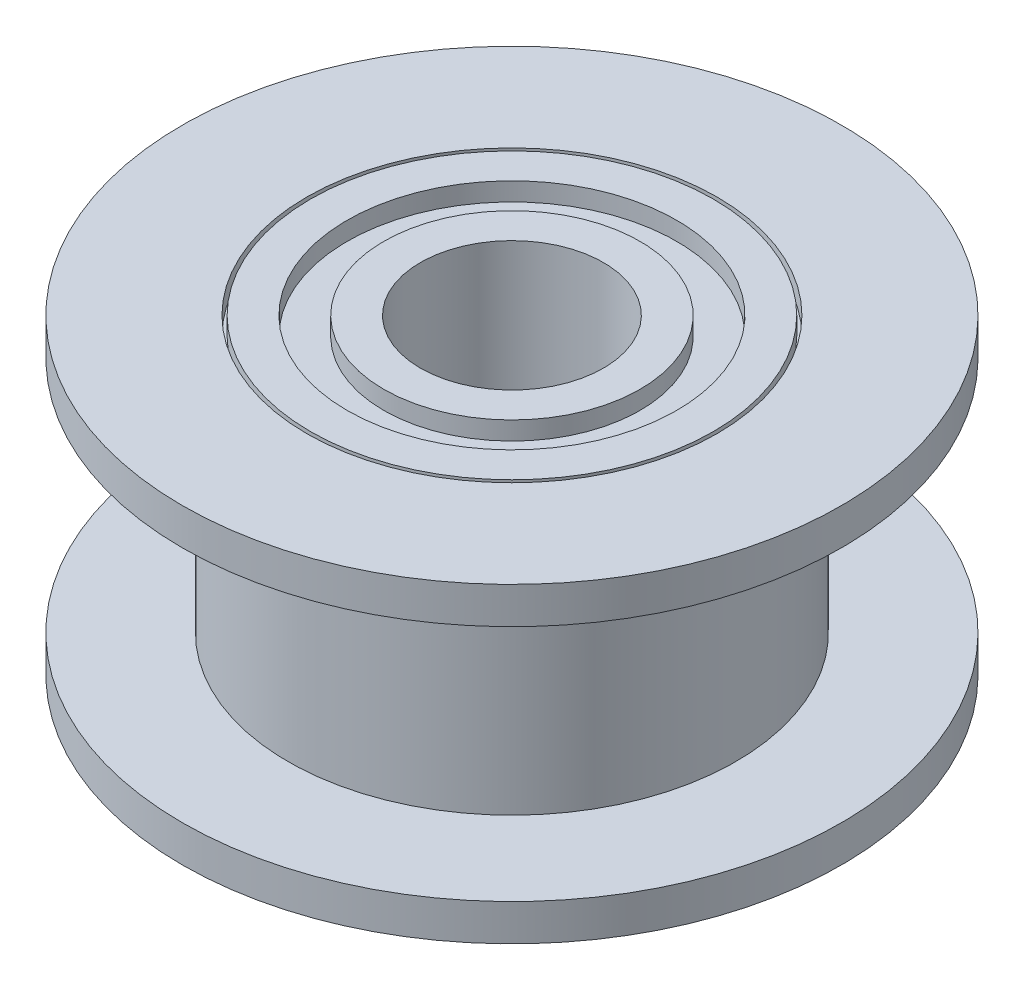
from build123d import *

# Parameters (mm, degrees)
BOSS_EXTRUDE1_OUTLINE_R = 9
BOSS_EXTRUDE1_DEPTH     = 1
SKETCH2_R               = 6.1121977
BOSS_EXTRUDE2_DEPTH     = 3.25
SKETCH3_R               = 2.5
CUT_EXTRUDE1_DEPTH      = 16.305227865
SKETCH4_R               = 5.6
SKETCH4_R_2             = 5.5
SKETCH4_R_3             = 4.5
SKETCH4_R_4             = 3.5
CUT_EXTRUDE2_DEPTH      = 0.5


# Read off the part's stored shape, not the designer's step: Boss-Extrude1
with BuildPart() as part:
    # Boss-Extrude1 outline → Boss-Extrude1 (new body)
    with BuildSketch(Plane(origin=(0, 0, 0), x_dir=(1, 0, 0), z_dir=(0, 1, 0))):
        Circle(BOSS_EXTRUDE1_OUTLINE_R)
    boss_extrude1 = extrude(amount=BOSS_EXTRUDE1_DEPTH)

    # Sketch2 → Boss-Extrude2 (add)
    with BuildSketch(Plane(origin=(0, 1, 0), x_dir=(1, 0, 0), z_dir=(0, 1, 0))):
        with Locations(Location((0, 0, 0), (0, 0, 90))):
            Circle(SKETCH2_R)
    boss_extrude2 = extrude(amount=BOSS_EXTRUDE2_DEPTH)

    # Mirror1: Boss-Extrude2 across plane
    add(boss_extrude2.mirror(Plane.ZX.offset(4.25)))

    # Mirror2: Boss-Extrude1 across plane
    add(boss_extrude1.mirror(Plane.ZX.offset(4.25)))

    # Sketch3 → Cut-Extrude1 (cut, through all)
    with BuildSketch(Plane(origin=(0, 8.5, 0), x_dir=(1, 0, 0), z_dir=(0, 1, 0))):
        with Locations(Location((0, 0, 0), (0, 0, 270))):
            Circle(SKETCH3_R)
    extrude(amount=-CUT_EXTRUDE1_DEPTH, mode=Mode.SUBTRACT)

    # Sketch4 → Cut-Extrude2 (cut)
    # profile 1 of 2: a face of its own
    with BuildSketch(Plane(origin=(0, 8.5, 0), x_dir=(1, 0, 0), z_dir=(0, 1, 0))):
        with Locations(Location((0, 0, 0), (0, 0, 270))):
            Circle(SKETCH4_R)
        with Locations(Location((0, 0, 0), (0, 0, 270))):
            Circle(SKETCH4_R_2, mode=Mode.SUBTRACT)
    # profile 2 of 2: a face of its own
    with BuildSketch(Plane(origin=(0, 8.5, 0), x_dir=(1, 0, 0), z_dir=(0, 1, 0))):
        with Locations(Location((0, 0, 0), (0, 0, 270))):
            Circle(SKETCH4_R_3)
        with Locations(Location((0, 0, 0), (0, 0, 270))):
            Circle(SKETCH4_R_4, mode=Mode.SUBTRACT)
    cut_extrude2 = extrude(amount=-CUT_EXTRUDE2_DEPTH, mode=Mode.SUBTRACT)

    # Mirror3: Cut-Extrude2 across plane
    add(cut_extrude2.mirror(Plane.ZX.offset(4.25)), mode=Mode.SUBTRACT)


solid = part.part
